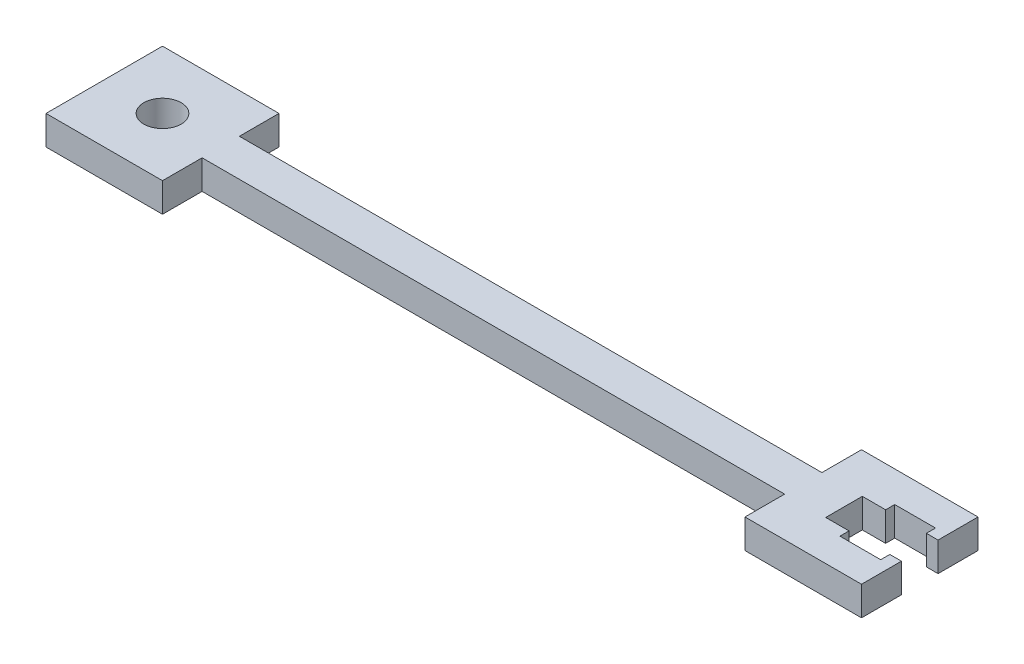
from build123d import *

# Parameters (mm, degrees)
SKETCH1_R           = 6.4
BOSS_EXTRUDE1_DEPTH = 10


with BuildPart() as part:
    # Sketch1 → Boss-Extrude1 (new body)
    with BuildSketch(Plane(origin=(0, 0, 0), x_dir=(1, 0, 0), z_dir=(0, 1, 0))):
        Polygon((20, 6.4), (220, 6.4), (220, 20), (260, 20), (260, 6.285), (256, 6.285), (256, 9.41), (242, 9.41), (242, 6.285), (234, 6.285), (234, -6.285), (242, -6.285), (242, -9.41), (256, -9.41), (256, -6.285), (260, -6.285), (260, -20), (220, -20), (220, -6.4), (20, -6.4), (20, -20), (-20, -20), (-20, 20), (20, 20), align=None)
        Circle(SKETCH1_R, mode=Mode.SUBTRACT)
    extrude(amount=BOSS_EXTRUDE1_DEPTH)


solid = part.part
